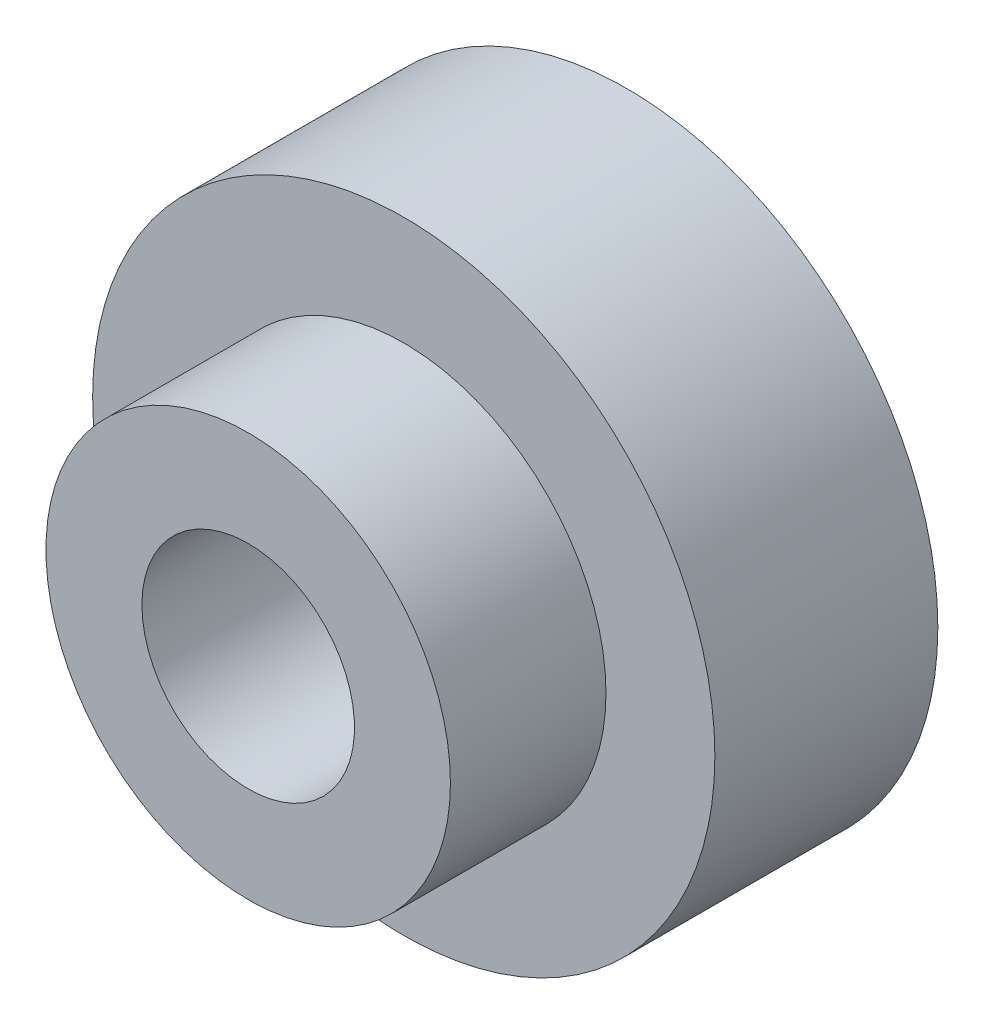
from build123d import *

# Parameters (mm, degrees)
SKETCH1_R           = 6
SKETCH1_R_2         = 2.05
BOSS_EXTRUDE1_DEPTH = 4.3
SKETCH2_R           = 3.9
SKETCH2_R_2         = 2.05
BOSS_EXTRUDE2_DEPTH = 3


with BuildPart() as part:
    # Sketch1 → Boss-Extrude1 (new body)
    with BuildSketch(Plane.XY):
        Circle(SKETCH1_R)
        Circle(SKETCH1_R_2, mode=Mode.SUBTRACT)
    extrude(amount=BOSS_EXTRUDE1_DEPTH)

    # Sketch2 → Boss-Extrude2 (add)
    with BuildSketch(Plane.XY.offset(4.3)):
        Circle(SKETCH2_R)
        Circle(SKETCH2_R_2, mode=Mode.SUBTRACT)
    extrude(amount=BOSS_EXTRUDE2_DEPTH)


solid = part.part
